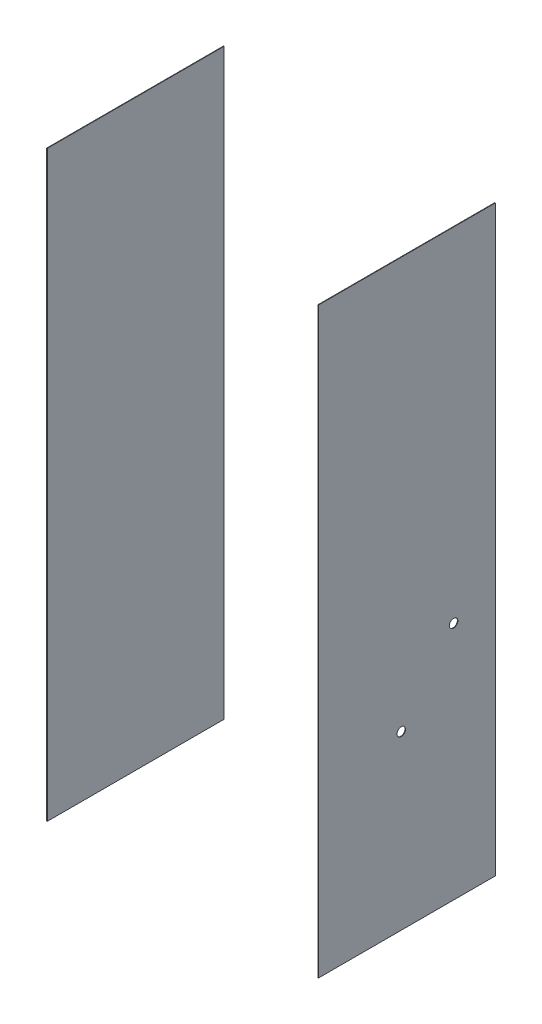
from build123d import *

# Parameters (mm, degrees)
BOSS_EXTRUDE1_OUTLINE_W = 596.9
BOSS_EXTRUDE1_OUTLINE_H = 1968.5
BOSS_EXTRUDE1_DEPTH     = 1.778
SKETCH3_R               = 14.2875
CUT_EXTRUDE1_DEPTH      = 2.54


# Read off the part's stored shape, not the designer's step: Boss-Extrude1
with BuildPart() as part:
    # Boss-Extrude1 outline → Boss-Extrude1 (new body)
    with BuildSketch(Plane(origin=(457.2, 0, 0), x_dir=(0, 0, -1), z_dir=(1, 0, 0))):
        Rectangle(BOSS_EXTRUDE1_OUTLINE_W, BOSS_EXTRUDE1_OUTLINE_H)
    extrude(amount=BOSS_EXTRUDE1_DEPTH)


with BuildPart() as body_2:
    # Mirror7: mirrored copy
    add(part.part.mirror(Plane(origin=(0, 0, 0), x_dir=(0, 0, 1), z_dir=(1, 0, 0))))


with BuildPart() as part_1:
    add(part.part)

    # Sketch3 → Cut-Extrude1 (cut)
    with BuildSketch(Plane(origin=(458.978, 0, 0), x_dir=(0, 0, -1), z_dir=(1, 0, 0))):
        with Locations((157.734, -174.68596)):
            Circle(SKETCH3_R)
        with Locations((-19.05, -403.46376)):
            Circle(SKETCH3_R)
    extrude(amount=-CUT_EXTRUDE1_DEPTH, mode=Mode.SUBTRACT)


solid = Compound([body_2.part, part_1.part])
